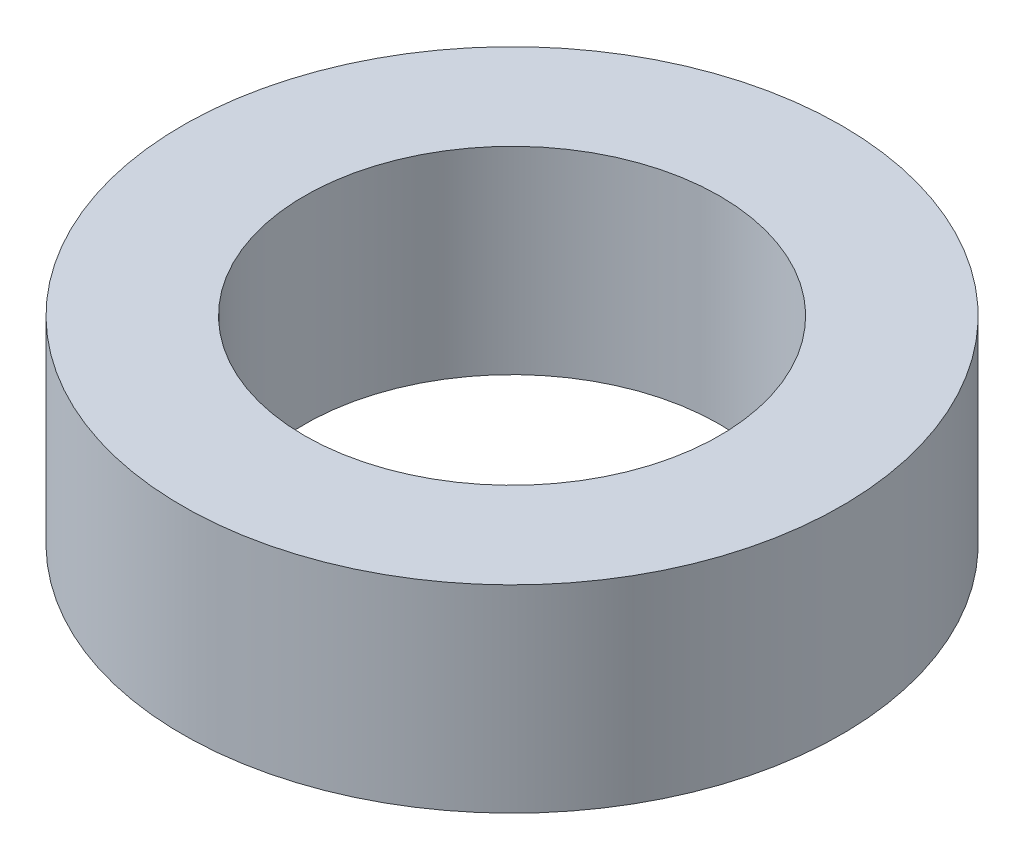
from build123d import *

# Parameters (mm, degrees)
SKETCH1_R           = 6.35
BOSS_EXTRUDE1_DEPTH = 3.81
SKETCH3_R           = 4
CUT_EXTRUDE2_DEPTH  = 10.7550551


with BuildPart() as part:
    # Sketch1 → Boss-Extrude1 (new body)
    with BuildSketch(Plane(origin=(0, 0, 0), x_dir=(1, 0, 0), z_dir=(0, 1, 0))):
        Circle(SKETCH1_R)
    extrude(amount=BOSS_EXTRUDE1_DEPTH)

    # Sketch3 → Cut-Extrude2 (cut, through all)
    with BuildSketch(Plane(origin=(0, 3.81, 0), x_dir=(1, 0, 0), z_dir=(0, 1, 0))):
        Circle(SKETCH3_R)
    extrude(amount=-CUT_EXTRUDE2_DEPTH, mode=Mode.SUBTRACT)


solid = part.part
